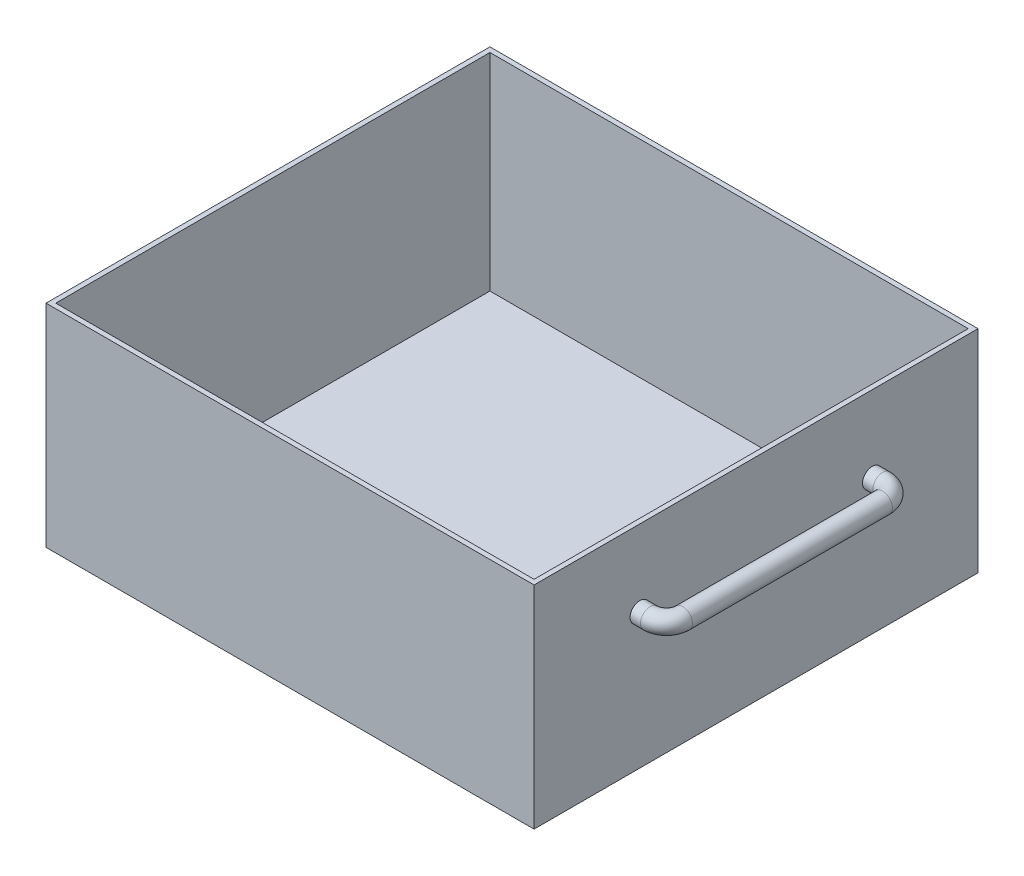
from build123d import *

# Parameters (mm, degrees)
SKETCH1_W           = 300
SKETCH1_H           = 272.875
BOSS_EXTRUDE1_DEPTH = 130
SHELL1_T            = -3
SKETCH2_R           = 6


with BuildPart() as part:
    # Sketch1 → Boss-Extrude1 (new body)
    with BuildSketch(Plane(origin=(0, 0, 0), x_dir=(1, 0, 0), z_dir=(0, 1, 0))):
        with Locations((13.179916318, -16.563023013)):
            Rectangle(SKETCH1_W, SKETCH1_H)
    extrude(amount=BOSS_EXTRUDE1_DEPTH)

    # Shell1
    shell1_openings = [part.faces().sort_by_distance(p)[0] for p in [
        (13.179916318, 130, 16.563023013),
    ]]
    offset(amount=SHELL1_T, openings=shell1_openings, kind=Kind.INTERSECTION)

    # Sweep2: sweep along a path in Sketch4
    with BuildLine(Plane(origin=(0, 83.172395684, 0), x_dir=(1, 0, 0), z_dir=(0, 1, 0))) as sweep2_path:
        Line((163.179916318, -88.000523013), (169.565605174, -88.000523013))
        ThreePointArc((169.565605174, -88.000523013), (176.636672985, -85.071590824), (179.565605174, -78.000523013))
        Line((179.565605174, -78.000523013), (179.565605174, 44.874476987))
        ThreePointArc((179.565605174, 44.874476987), (176.636672985, 51.945544799), (169.565605174, 54.874476987))
        Line((169.565605174, 54.874476987), (163.179916318, 54.874476987))
    # Sketch2 → Sweep2 (sweep)
    with BuildSketch(Plane(origin=(163.179916318, 0, 0), x_dir=(0, 0, -1), z_dir=(1, 0, 0))):
        with Locations((-88.000523013, 83.172395684)):
            Circle(SKETCH2_R)
    sweep(path=sweep2_path.line)


solid = part.part
